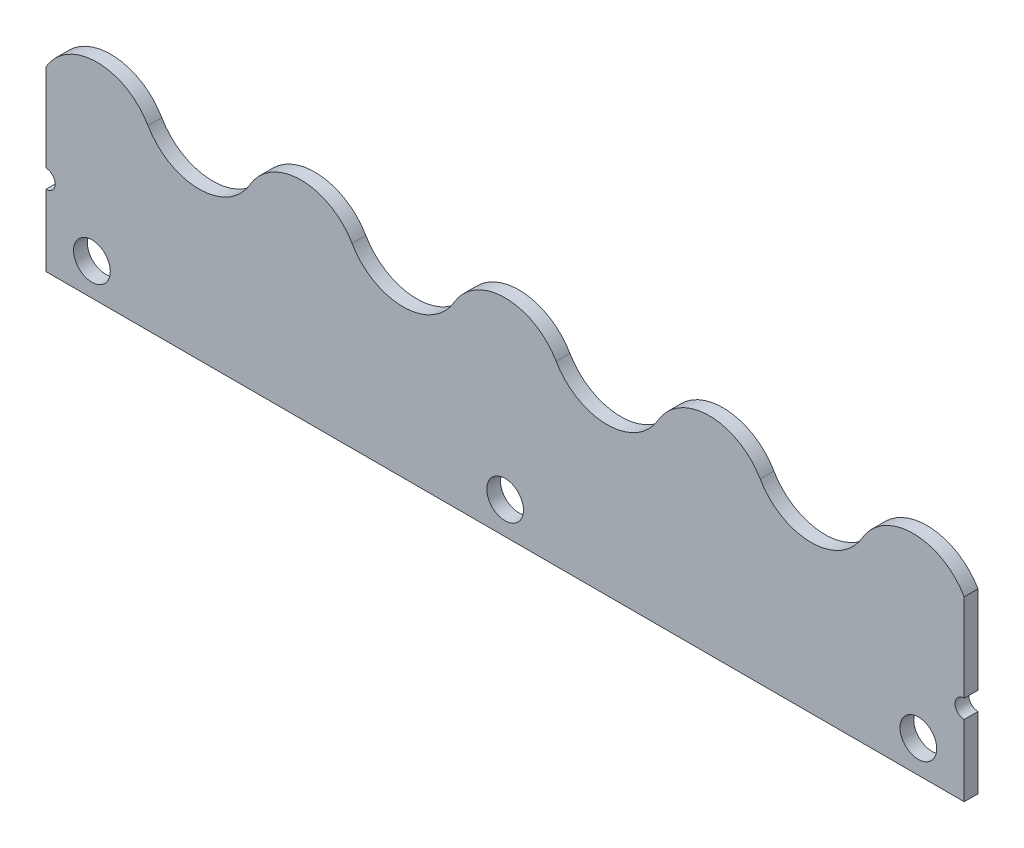
from build123d import *

# Parameters (mm, degrees)
SM_BASE_FLANGE_1_DEPTH    = 100
CUT_EXTRUDE_1_DEPTH       = 1.5
SKETCH_7_R                = 2
CUT_EXTRUDE_2_DEPTH       = 1.5
CUT_EXTRUDE_START         = -10
CUT_EXTRUDE_3_OUTLINE_W   = 100
CUT_EXTRUDE_3_OUTLINE_H   = 4
CUT_EXTRUDE_3_DEPTH       = 8.5
CUT_EXTRUDE_START_2       = -1.5
CUT_EXTRUDE_3_2_DEPTH     = 1.5
CUT_EXTRUDE_3_3_OUTLINE_R = 2
CUT_EXTRUDE_3_3_DEPTH     = 1.5


# Read off the part's stored shape, not the designer's step: Вырез-Вытянуть3
# Sheet-metal steps are written as plain solids
with BuildPart() as part:
    # Sketch 1 → Базовая кромка1 (new body)
    with BuildSketch(Plane(origin=(0, 0, 0), x_dir=(0, 0, -1), z_dir=(1, 0, 0))):
        with BuildLine():
            Line((10, 0), (3, 0))
            ThreePointArc((3, 0), (0.878679656, 0.878679656), (0, 3))
            Line((0, 3), (0, 15))
            Line((0, 15), (1.5, 15))
            Line((1.5, 15), (1.5, 3))
            ThreePointArc((1.5, 3), (1.939339828, 1.939339828), (3, 1.5))
            Line((3, 1.5), (10, 1.5))
            Line((10, 1.5), (10, 0))
        make_face()
    extrude(amount=SM_BASE_FLANGE_1_DEPTH)

    # Эскиз6 → Вырез-Вытянуть1 (cut)
    with BuildSketch(Plane.XY):
        with BuildLine():
            Line((0, 11.792498505), (0, 18.792498505))
            Line((0, 18.792498505), (100, 18.792498505))
            Line((100, 18.792498505), (100, 11.792498505))
            ThreePointArc((100, 11.792498505), (94.444444444, 15), (88.888888889, 11.792498505))
            ThreePointArc((88.888888889, 11.792498505), (83.333333333, 8.584997009), (77.777777778, 11.792498505))
            ThreePointArc((77.777777778, 11.792498505), (72.222222222, 15), (66.666666667, 11.792498505))
            ThreePointArc((66.666666667, 11.792498505), (61.111111111, 8.584997009), (55.555555556, 11.792498505))
            ThreePointArc((55.555555556, 11.792498505), (50, 15), (44.444444444, 11.792498505))
            ThreePointArc((44.444444444, 11.792498505), (38.888888889, 8.584997009), (33.333333333, 11.792498505))
            ThreePointArc((33.333333333, 11.792498505), (27.777777778, 15), (22.222222222, 11.792498505))
            ThreePointArc((22.222222222, 11.792498505), (16.666666667, 8.584997009), (11.111111111, 11.792498505))
            ThreePointArc((11.111111111, 11.792498505), (5.555555556, 15), (0, 11.792498505))
        make_face()
    extrude(amount=-CUT_EXTRUDE_1_DEPTH, mode=Mode.SUBTRACT)

    # Эскиз7 → Вырез-Вытянуть2 (cut)
    with BuildSketch(Plane(origin=(0, 1.5, 0), x_dir=(1, 0, 0), z_dir=(0, 1, 0))):
        with Locations(Location((50, 6.5, 0), (0, 0, 270))):
            Circle(SKETCH_7_R)
        with Locations(Location((95, 6.5, 0), (0, 0, 270))):
            Circle(SKETCH_7_R)
        with Locations(Location((5, 6.5, 0), (0, 0, 270))):
            Circle(SKETCH_7_R)
    extrude(amount=-CUT_EXTRUDE_2_DEPTH, mode=Mode.SUBTRACT)

    # Вырез-Вытянуть3 outline → Вырез-Вытянуть3 (cut)
    with BuildSketch(Plane.XY.offset(CUT_EXTRUDE_START)):
        with Locations((50, 2)):
            Rectangle(CUT_EXTRUDE_3_OUTLINE_W, CUT_EXTRUDE_3_OUTLINE_H)
    extrude(amount=CUT_EXTRUDE_3_DEPTH, mode=Mode.SUBTRACT)

    # Cut-Extrude 3 2 outline → Cut-Extrude 3 2 (cut)
    with BuildSketch(Plane.XY.offset(CUT_EXTRUDE_START_2)):
        with BuildLine():
            ThreePointArc((0, 0.232854132), (1, 1.232854132), (0, 2.232854132))
            Line((0, 2.232854132), (0, 0.232854132))
        make_face()
        with BuildLine():
            Line((100, 0.232854132), (100, 2.232854132))
            ThreePointArc((100, 2.232854132), (99, 1.232854132), (100, 0.232854132))
        make_face()
    extrude(amount=CUT_EXTRUDE_3_2_DEPTH, mode=Mode.SUBTRACT)

    # Cut-Extrude 3 3 outline → Cut-Extrude 3 3 (add)
    with BuildSketch(Plane.XY.offset(CUT_EXTRUDE_START_2)):
        with BuildLine():
            Line((0, 0.232854132), (0, -7.534291735))
            Line((0, -7.534291735), (100, -7.534291735))
            Line((100, -7.534291735), (100, 0.232854132))
            ThreePointArc((100, 0.232854132), (99, 1.232854132), (100, 2.232854132))
            Line((100, 2.232854132), (100, 4))
            Line((100, 4), (0, 4))
            Line((0, 4), (0, 2.232854132))
            ThreePointArc((0, 2.232854132), (1, 1.232854132), (0, 0.232854132))
        make_face()
        with Locations((95, -4.034291735)):
            Circle(CUT_EXTRUDE_3_3_OUTLINE_R, mode=Mode.SUBTRACT)
        with Locations((5, -4.034291735)):
            Circle(CUT_EXTRUDE_3_3_OUTLINE_R, mode=Mode.SUBTRACT)
        with Locations((50, -4.034291735)):
            Circle(CUT_EXTRUDE_3_3_OUTLINE_R, mode=Mode.SUBTRACT)
    extrude(amount=CUT_EXTRUDE_3_3_DEPTH)


solid = part.part
